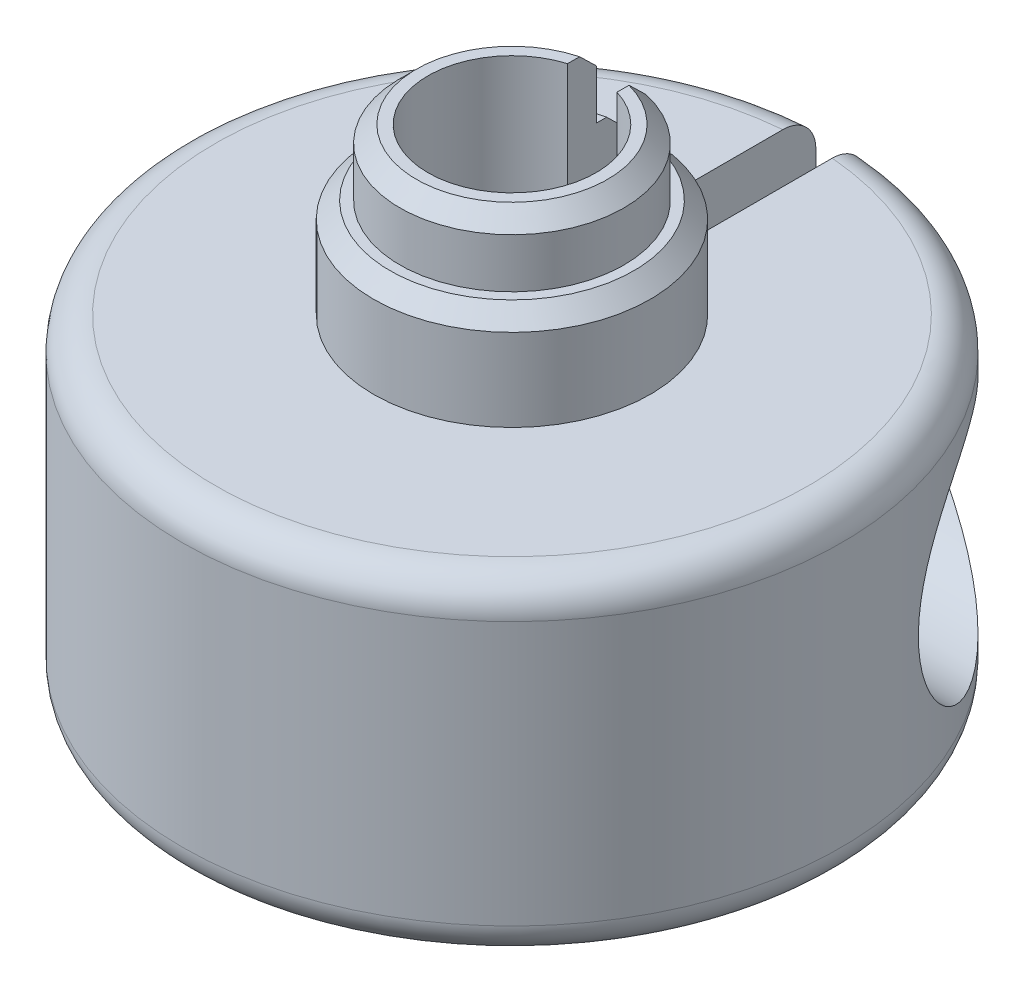
from build123d import *

# Parameters (mm, degrees)
SKETCH1_R              = 4.05
BOSS_EXTRUDE1_DEPTH    = 8
SKETCH2_R              = 10
BOSS_EXTRUDE2_DEPTH    = 10
FILLET1_R              = 1
SKETCH3_R              = 2.55
CUT_EXTRUDE1_DEPTH     = 10
CUT_EXTRUDE2_REACH     = 24.891
M2_5_CLEARANCE_HOLE1_D = 2.9
SKETCH28_R             = 3.5
CUT_EXTRUDE3_DEPTH     = 6.5
SKETCH29_W             = 8.1
SKETCH29_H             = 0.5
CUT_EXTRUDE7_DEPTH     = 23.891046451
FILLET2_R              = 0.25
BOSS_EXTRUDE3_START    = 5
BOSS_EXTRUDE3_DEPTH    = 5
CHAMFER1_SIZE          = 0.5
CUT_EXTRUDE8_DEPTH     = 7
BOSS_EXTRUDE4_START    = -2
BOSS_EXTRUDE4_DEPTH    = 3
CHAMFER2_SIZE          = 0.5
SKETCH35_R             = 4.05
CUT_EXTRUDE9_DEPTH     = 8


with BuildPart() as part:
    # Sketch1 → Boss-Extrude1 (new body)
    with BuildSketch(Plane(origin=(0, 0, 0), x_dir=(1, 0, 0), z_dir=(0, 1, 0))):
        with Locations(Location((0, 0, 0), (0, 0, 270))):
            Circle(SKETCH1_R)
    extrude(amount=BOSS_EXTRUDE1_DEPTH)

    # Sketch2 → Boss-Extrude2 (add)
    with BuildSketch(Plane(origin=(0, 8, 0), x_dir=(1, 0, 0), z_dir=(0, 1, 0))):
        with Locations(Location((0, 0, 0), (0, 0, 270))):
            Circle(SKETCH2_R)
    extrude(amount=BOSS_EXTRUDE2_DEPTH)

    # Fillet1
    fillet1_edges = [part.edges().sort_by_distance(p)[0] for p in [
        (0, 0, -4.05),
        (0, 8, -10),
        (0, 18, -10),
    ]]
    fillet(fillet1_edges, radius=FILLET1_R)

    # Sketch3 → Cut-Extrude1 (cut)
    with BuildSketch(Plane(origin=(0, 18, 0), x_dir=(1, 0, 0), z_dir=(0, 1, 0))):
        with Locations(Location((0, 0, 0), (0, 0, 270))):
            Circle(SKETCH3_R)
    extrude(amount=-CUT_EXTRUDE1_DEPTH, mode=Mode.SUBTRACT)

    # Cut-Extrude2: up to this face of the body (flat: up to its plane)
    cut_extrude2_end = Plane(part.part.faces().sort_by_distance((0, 8, -8.745441559))[0])
    # Sketch20 → Cut-Extrude2 (cut, up to the picked face)
    with BuildSketch(Plane(origin=(0, 18, 0), x_dir=(1, 0, 0), z_dir=(0, 1, 0)), mode=Mode.PRIVATE) as cut_extrude2_sk1:
        with BuildLine():
            Line((-0.75, 2.437211521), (0.75, 2.437211521))
            Line((0.75, 2.437211521), (0.75, 9.971835338))
            ThreePointArc((0.75, 9.971835338), (0, 10), (-0.75, 9.971835338))
            Line((-0.75, 9.971835338), (-0.75, 2.437211521))
        make_face()
    cut_extrude2_tool1 = split(extrude(cut_extrude2_sk1.sketch, amount=-CUT_EXTRUDE2_REACH, mode=Mode.PRIVATE), bisect_by=cut_extrude2_end, keep=Keep.BOTH, mode=Mode.PRIVATE)
    add(cut_extrude2_tool1.solids().sort_by(Axis((0, 18, -6.213919), (0, -1, 0)))[0], mode=Mode.SUBTRACT)

    # M2.5 Clearance Hole1 (through all)
    with Locations(Plane(origin=(10, 0, 0), x_dir=(0, 0, -1), z_dir=(1, 0, 0))):
        with Locations((6.204523429, 13)):
            Hole(M2_5_CLEARANCE_HOLE1_D / 2)

    # Sketch28 → Cut-Extrude3 (cut)
    with BuildSketch(Plane(origin=(10, 0, 0), x_dir=(0, 0, -1), z_dir=(1, 0, 0))):
        with Locations((6.204523429, 13)):
            Circle(SKETCH28_R)
    extrude(amount=-CUT_EXTRUDE3_DEPTH, mode=Mode.SUBTRACT)

    # Sketch29 → Cut-Extrude7 (cut, through all)
    with BuildSketch(Plane.XY):
        with Locations((0, 7.75)):
            Rectangle(SKETCH29_W, SKETCH29_H)
    extrude(amount=-CUT_EXTRUDE7_DEPTH, mode=Mode.SUBTRACT)

    # Fillet2
    fillet2_edges = [part.edges().sort_by_distance(p)[0] for p in [
        (-3.3, 8, 0),
        (3.3, 8, 0),
        (0, 7.5, 0),
    ]]
    fillet(fillet2_edges, radius=FILLET2_R - 0.0001)  # a hair under: the kernel refuses the full size

    # Sketch30 → Boss-Extrude3 (add)
    with BuildSketch(Plane(origin=(0, 18, 0), x_dir=(1, 0, 0), z_dir=(0, 1, 0)).offset(BOSS_EXTRUDE3_START)):
        with BuildLine():
            Line((-0.75, 3.31624788), (-0.75, 2.437211521))
            ThreePointArc((-0.75, 2.437211521), (0, -2.55), (0.75, 2.437211521))
            Line((0.75, 2.437211521), (0.75, 3.31624788))
            ThreePointArc((0.75, 3.31624788), (0, -3.4), (-0.75, 3.31624788))
        make_face()
    extrude(amount=-BOSS_EXTRUDE3_DEPTH)

    # Chamfer1
    chamfer1_edges = [part.edges().sort_by_distance(p)[0] for p in [
        (0, 23, 3.4),
    ]]
    chamfer(chamfer1_edges, length=CHAMFER1_SIZE)

    # Sketch33 → Cut-Extrude8 (cut)
    with BuildSketch(Plane.ZY.offset(10)):
        Polygon((-3.144567003, 13), (-4.674545216, 15.65), (-7.734501643, 15.65), (-9.264479856, 13), (-7.734501643, 10.35), (-4.674545216, 10.35), align=None)
    extrude(amount=-CUT_EXTRUDE8_DEPTH, mode=Mode.SUBTRACT)

    # Sketch34 → Boss-Extrude4 (add)
    with BuildSketch(Plane(origin=(0, 23, 0), x_dir=(1, 0, 0), z_dir=(0, 1, 0)).offset(BOSS_EXTRUDE4_START)):
        with BuildLine():
            Line((-0.75, 3.31624788), (-0.75, 4.132493194))
            ThreePointArc((-0.75, 4.132493194), (0, -4.2), (0.75, 4.132493194))
            Line((0.75, 4.132493194), (0.75, 3.31624788))
            ThreePointArc((0.75, 3.31624788), (0, -3.4), (-0.75, 3.31624788))
        make_face()
    extrude(amount=-BOSS_EXTRUDE4_DEPTH)

    # Chamfer2
    chamfer2_edges = [part.edges().sort_by_distance(p)[0] for p in [
        (0, 21, 4.2),
    ]]
    chamfer(chamfer2_edges, length=CHAMFER2_SIZE)

    # Sketch35 → Cut-Extrude9 (cut)
    with BuildSketch(Plane.XZ):
        Circle(SKETCH35_R)
    extrude(amount=-CUT_EXTRUDE9_DEPTH, mode=Mode.SUBTRACT)


solid = part.part
